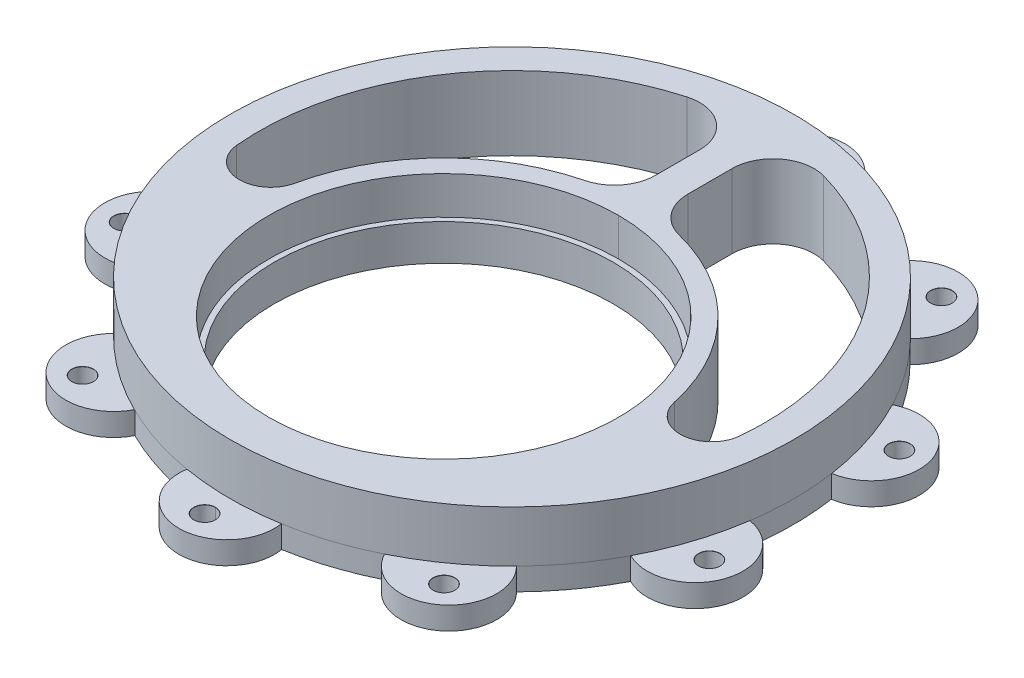
from build123d import *

# Parameters (mm, degrees)
SKETCH1_R                  = 61.9125
SKETCH1_R_2                = 30.988
SLOTTED_BODY_EXTRUDE_DEPTH = 4.191
SKETCH5_R                  = 52.3875
BOSS_EXTRUDE3_DEPTH        = 9.525
SKETCH6_R                  = 32.512
CUT_EXTRUDE5_DEPTH         = 89.62530095
SKETCH8_R                  = 32.512
SKETCH8_R_2                = 31.496
BOSS_EXTRUDE4_DEPTH        = 6.700000062
CIRPATTERN1_COUNT          = 10
CUT_EXTRUDE9_DEPTH         = 89.074065067
CIRPATTERN6_COUNT          = 10


with BuildPart() as part:
    # Sketch1 → Slotted-Body Extrude (new body)
    with BuildSketch(Plane(origin=(0, 0, 0), x_dir=(1, 0, 0), z_dir=(0, 1, 0))):
        Circle(SKETCH1_R)
        with Locations((0, -12.7)):
            Circle(SKETCH1_R_2, mode=Mode.SUBTRACT)
    extrude(amount=SLOTTED_BODY_EXTRUDE_DEPTH)

    # Sketch5 → Boss-Extrude3 (add)
    with BuildSketch(Plane(origin=(0, 4.191, 0), x_dir=(1, 0, 0), z_dir=(0, 1, 0))):
        Circle(SKETCH5_R)
    extrude(amount=BOSS_EXTRUDE3_DEPTH)

    # Sketch6 → Cut-Extrude5 (cut, through all)
    with BuildSketch(Plane.XZ):
        with Locations((0, 12.7)):
            Circle(SKETCH6_R)
        with BuildLine():
            Line((3.013951015, -37.906674687), (3.013951015, -29.674053734))
            ThreePointArc((3.013951015, -29.674053734), (4.62572071, -24.987309811), (8.779192117, -22.283230408))
            ThreePointArc((8.779192117, -22.283230408), (25.925135322, -12.375645206), (35.256203169, 5.09074497))
            ThreePointArc((35.256203169, 5.09074497), (41.313127715, 9.689980346), (46.782976949, 4.406037654))
            ThreePointArc((46.782976949, 4.406037654), (38.737451576, -26.59830719), (12.692135082, -45.243450433))
            ThreePointArc((12.692135082, -45.243450433), (6.03063496, -43.979061474), (3.013951015, -37.906674687))
        make_face()
        with BuildLine():
            Line((-3.013951015, -37.906674687), (-3.013951015, -29.674053734))
            ThreePointArc((-3.013951015, -29.674053734), (-4.62572071, -24.987309811), (-8.779192117, -22.283230408))
            ThreePointArc((-8.779192117, -22.283230408), (-25.925135322, -12.375645206), (-35.256203169, 5.09074497))
            ThreePointArc((-35.256203169, 5.09074497), (-41.313127715, 9.689980346), (-46.782976949, 4.406037654))
            ThreePointArc((-46.782976949, 4.406037654), (-38.737451576, -26.59830719), (-12.692135082, -45.243450433))
            ThreePointArc((-12.692135082, -45.243450433), (-6.03063496, -43.979061474), (-3.013951015, -37.906674687))
        make_face()
    extrude(amount=-CUT_EXTRUDE5_DEPTH, mode=Mode.SUBTRACT)

    # Sketch10 → Ø4.0mm Dowel Hole2 (revolve, cut)
    with BuildSketch(Plane(origin=(0, 4.191, -57.15), x_dir=(0, 0, 1), z_dir=(1, 0, 0))):
        Polygon((0, 0), (0, 4.191), (2, 4.191), (2, 0.025), (2.025, 0), align=None)
    f_4_0mm_dowel_hole2 = revolve(axis=Axis((0, 10.541, -57.15), (0, -1, 0)), mode=Mode.SUBTRACT)

    # CirPattern1: Ø4.0mm Dowel Hole2 ×10 about axis
    cirpattern1_axis = Axis((0, 13.716, 0), (0, -1, 0))
    for i in range(1, CIRPATTERN1_COUNT):
        add(f_4_0mm_dowel_hole2.rotate(cirpattern1_axis, i * 360 / CIRPATTERN1_COUNT), mode=Mode.SUBTRACT)

    # Sketch15 → Cut-Extrude9 (cut, through all)
    with BuildSketch(Plane(origin=(0, 4.191, 0), x_dir=(1, 0, 0), z_dir=(0, 1, 0))):
        with BuildLine():
            ThreePointArc((-23.222629114, 46.888276499), (-29.066654393, 51.534709081), (-36.391254433, 50.088264664))
            ThreePointArc((-36.391254433, 50.088264664), (-19.132014664, 58.882286565), (0, 61.9125))
            ThreePointArc((0, 61.9125), (-6.775924606, 58.777406232), (-8.772735825, 51.583331437))
            ThreePointArc((-8.772735825, 51.583331437), (-16.169005214, 49.763081159), (-23.222629114, 46.888276499))
        make_face()
    cut_extrude9 = extrude(amount=-CUT_EXTRUDE9_DEPTH, mode=Mode.SUBTRACT)

    # CirPattern6: Cut-Extrude9 ×10 about axis
    cirpattern6_axis = Axis((0, 4.191, 0), (0, 1, 0))
    for i in range(1, CIRPATTERN6_COUNT):
        add(cut_extrude9.rotate(cirpattern6_axis, i * 360 / CIRPATTERN6_COUNT), mode=Mode.SUBTRACT)


with BuildPart() as body_2:
    # Sketch8 → Boss-Extrude4 (new body)
    with BuildSketch(Plane.XZ):
        with Locations((0, 12.7)):
            Circle(SKETCH8_R)
        with Locations((0, 12.7)):
            Circle(SKETCH8_R_2, mode=Mode.SUBTRACT)
    extrude(amount=-BOSS_EXTRUDE4_DEPTH)


solid = Compound([part.part, body_2.part])
